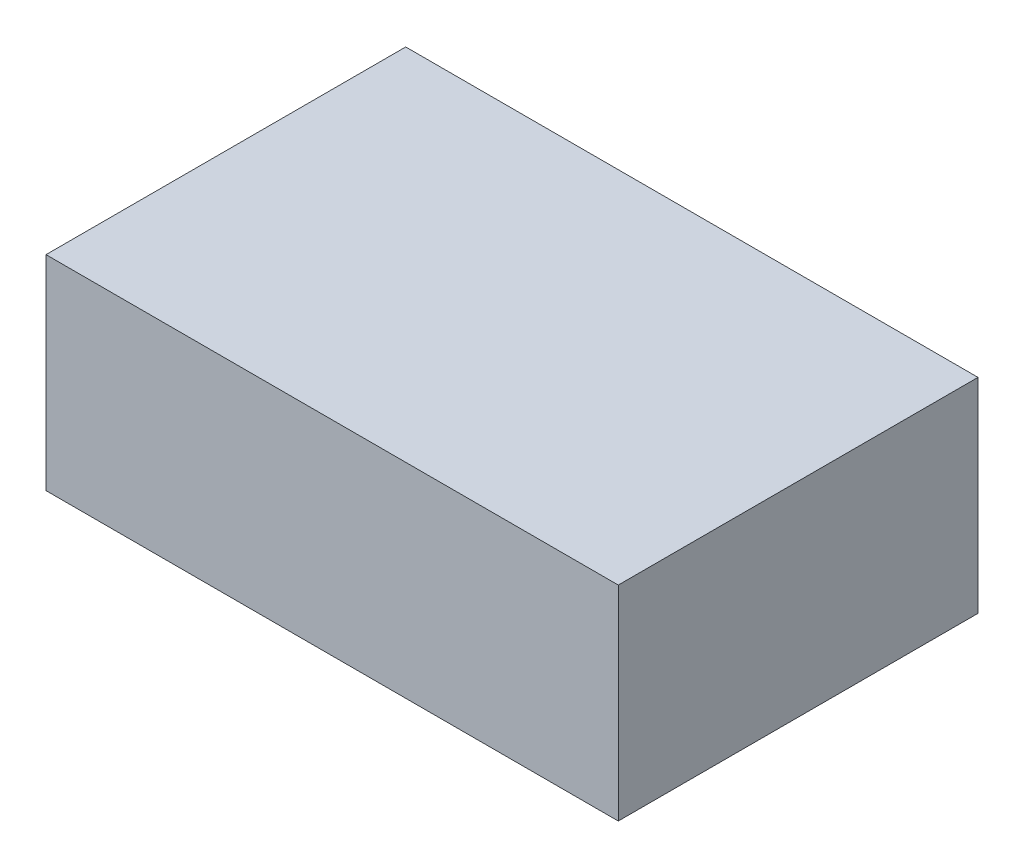
from build123d import *

# Parameters (mm, degrees)
SKETCH1_W           = 28
SKETCH1_H           = 17.6
BOSS_EXTRUDE1_DEPTH = 10


with BuildPart() as part:
    # Sketch1 → Boss-Extrude1 (new body)
    with BuildSketch(Plane(origin=(0, 0, 0), x_dir=(1, 0, 0), z_dir=(0, 1, 0))):
        with Locations((29.248180256, 30.933893827)):
            Rectangle(SKETCH1_W, SKETCH1_H)
    extrude(amount=BOSS_EXTRUDE1_DEPTH)


solid = part.part
